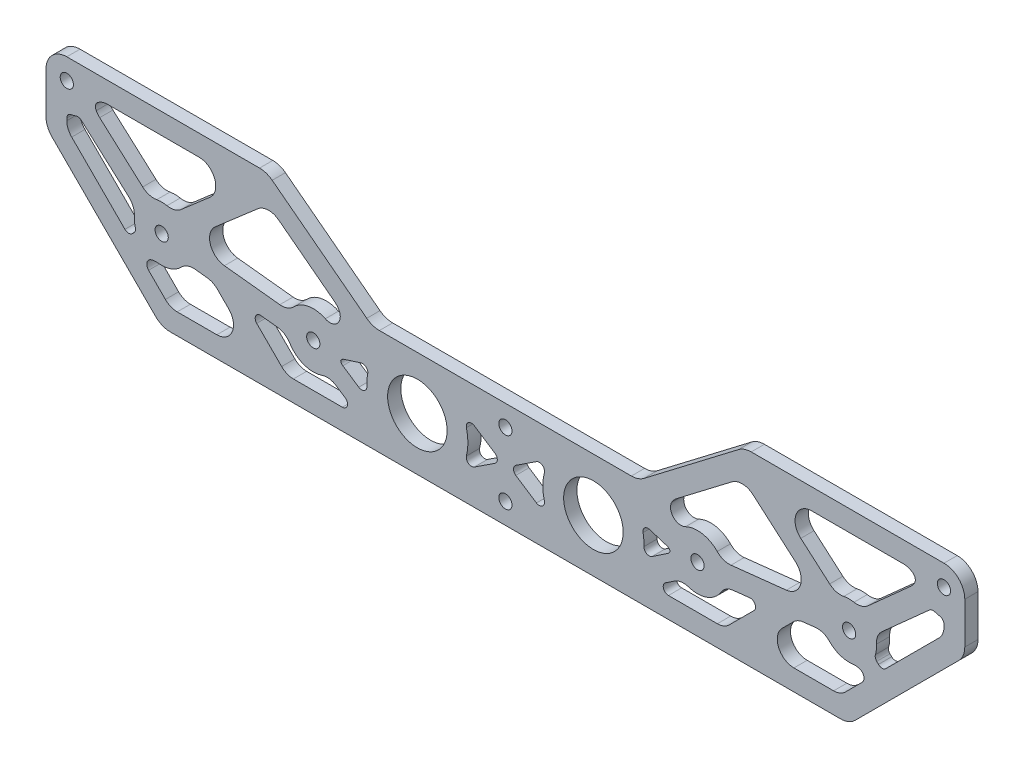
from build123d import *

# Parameters (mm, degrees)
SKETCH1_R           = 14.2875
SKETCH1_R_2         = 3.175
BOSS_EXTRUDE1_DEPTH = 6.35
FILLET1_R           = 10
CUT_EXTRUDE1_DEPTH  = 10
FILLET2_R           = 2.5
FILLET3_DEPTH       = 6.35
FILLET4_R           = 8
FILLET5_R           = 8
FILLET6_R           = 3
FILLET7_R           = 8
FILLET8_R           = 5
FILLET9_R           = 3
FILLET10_R          = 8


with BuildPart() as part:
    # Sketch1 → Boss-Extrude1 (new body)
    with BuildSketch(Plane.XY):
        Polygon((-62.442934658, -37.279495554), (267.757065342, -37.279495554), (323.315335232, 18.278774336), (323.315335232, 52.320504446), (217.352871158, 52.320504446), (166.552871158, 13.520504446), (38.761259526, 13.520504446), (-12.038740474, 52.320504446), (-118.001204548, 52.320504446), (-118.001204548, 18.278774336), align=None)
        with Locations((60.373820223, -11.879495554)):
            Circle(SKETCH1_R, mode=Mode.SUBTRACT)
        with Locations((-62.442934658, 1.520504446)):
            Circle(SKETCH1_R_2, mode=Mode.SUBTRACT)
        with Locations((10.373820223, -6.424213816)):
            Circle(SKETCH1_R_2, mode=Mode.SUBTRACT)
        with Locations((102.657065342, -27.279495554)):
            Circle(SKETCH1_R_2, mode=Mode.SUBTRACT)
        with Locations((144.940310462, -11.879495554)):
            Circle(SKETCH1_R, mode=Mode.SUBTRACT)
        with Locations((194.940310462, -6.424213816)):
            Circle(SKETCH1_R_2, mode=Mode.SUBTRACT)
        with Locations((102.657065342, 3.520504446)):
            Circle(SKETCH1_R_2, mode=Mode.SUBTRACT)
        with Locations((267.757065342, 1.520504446)):
            Circle(SKETCH1_R_2, mode=Mode.SUBTRACT)
        with Locations((313.315335232, 42.320504446)):
            Circle(SKETCH1_R_2, mode=Mode.SUBTRACT)
        with Locations((-108.001204548, 42.320504446)):
            Circle(SKETCH1_R_2, mode=Mode.SUBTRACT)
    extrude(amount=BOSS_EXTRUDE1_DEPTH)

    # Fillet1
    fillet1_edges = [part.edges().sort_by_distance(p)[0] for p in [
        (-118.001204548, 18.278774336, 3.175),
        (-118.001204548, 52.320504446, 3.175),
        (-12.038740474, 52.320504446, 3.175),
        (38.761259526, 13.520504446, 3.175),
        (166.552871158, 13.520504446, 3.175),
        (217.352871158, 52.320504446, 3.175),
        (323.315335232, 52.320504446, 3.175),
        (323.315335232, 18.278774336, 3.175),
        (267.757065342, -37.279495554, 3.175),
        (-62.442934658, -37.279495554, 3.175),
    ]]
    fillet(fillet1_edges, radius=FILLET1_R)

    # Sketch2 → Cut-Extrude1 (cut)
    with BuildSketch(Plane.XY.offset(6.35)):
        with BuildLine():
            ThreePointArc((23.505920872, -7.486549706), (23.419545179, -8.265323632), (23.28702714, -9.037585605))
            Line((23.28702714, -9.037585605), (36.905820905, -18.135345959))
            ThreePointArc((36.905820905, -18.135345959), (36.127690836, -10.462503664), (37.794303215, -2.932536966))
            Line((37.794303215, -2.932536966), (23.505920872, -7.486549706))
        make_face()
        with BuildLine():
            Line((-74.858923583, 5.927753475), (-102.256554243, 30.463876853))
            ThreePointArc((-102.256554243, 30.463876853), (-105.054209768, 29.479326667), (-108.001204548, 29.145504446))
            Line((-108.001204548, 29.145504446), (-108.001204548, 22.42090996))
            Line((-108.001204548, 22.42090996), (-78.307400752, -7.272893836))
            Line((-78.307400752, -7.272893836), (-74.597651385, -3.563144469))
            ThreePointArc((-74.597651385, -3.563144469), (-75.612945288, 1.157951013), (-74.858923583, 5.927753475))
        make_face()
        with BuildLine():
            Line((-23.050139283, 42.320504446), (-94.826204548, 42.320504446))
            ThreePointArc((-94.826204548, 42.320504446), (-95.017343814, 40.084439722), (-95.585215622, 37.913255418))
            Line((-95.585215622, 37.913255418), (-68.187584962, 13.377132039))
            ThreePointArc((-68.187584962, 13.377132039), (-62.339595002, 14.695099162), (-56.512999229, 13.285558242))
            Line((-56.512999229, 13.285558242), (-23.050139283, 42.320504446))
        make_face()
        with BuildLine():
            Line((-67.526583573, -10.63421228), (-71.23633294, -14.343961648))
            Line((-71.23633294, -14.343961648), (-58.300799034, -27.279495554))
            Line((-58.300799034, -27.279495554), (-16.619224161, -27.279495554))
            Line((-16.619224161, -27.279495554), (-37.688728757, -6.209990957))
            Line((-37.688728757, -6.209990957), (-50.867789262, -4.772081195))
            ThreePointArc((-50.867789262, -4.772081195), (-58.069603335, -10.907471984), (-67.526583573, -10.63421228))
        make_face()
        with BuildLine():
            Line((30.003625706, 7.626245825), (-11.363222422, 39.221397545))
            Line((-11.363222422, 39.221397545), (-49.959338032, 5.732444651))
            ThreePointArc((-49.959338032, 5.732444651), (-49.868096719, 5.45167168), (-49.783169494, 5.168924788))
            Line((-49.783169494, 5.168924788), (-1.201325173, -0.131628174))
            ThreePointArc((-1.201325173, -0.131628174), (9.059387493, 6.685053578), (20.46921657, 2.041221648))
            Line((20.46921657, 2.041221648), (32.633437977, 5.926134389))
            ThreePointArc((32.633437977, 5.926134389), (31.285206333, 6.724640645), (30.003625706, 7.626245825))
        make_face()
        with BuildLine():
            Line((-21.814640677, -7.941943413), (-2.477088537, -27.279495554))
            Line((-2.477088537, -27.279495554), (32.591759865, -27.279495554))
            Line((32.591759865, -27.279495554), (17.732180345, -17.352853315))
            ThreePointArc((17.732180345, -17.352853315), (5.870863239, -18.805813204), (-2.285944941, -10.072634157))
            Line((-2.285944941, -10.072634157), (-21.814640677, -7.941943413))
        make_face()
        with BuildLine():
            Line((187.581950339, -17.352853315), (172.722370819, -27.279495554))
            Line((172.722370819, -27.279495554), (207.791219222, -27.279495554))
            Line((207.791219222, -27.279495554), (227.128771362, -7.941943413))
            Line((227.128771362, -7.941943413), (207.600075626, -10.072634157))
            ThreePointArc((207.600075626, -10.072634157), (199.443267446, -18.805813204), (187.581950339, -17.352853315))
        make_face()
        with BuildLine():
            Line((243.002859442, -6.209990957), (221.933354845, -27.279495554))
            Line((221.933354845, -27.279495554), (263.614929719, -27.279495554))
            Line((263.614929719, -27.279495554), (276.550463625, -14.343961648))
            Line((276.550463625, -14.343961648), (272.840714257, -10.63421228))
            ThreePointArc((272.840714257, -10.63421228), (263.38373402, -10.907471984), (256.181919946, -4.772081195))
            Line((256.181919946, -4.772081195), (243.002859442, -6.209990957))
        make_face()
        with BuildLine():
            Line((168.408309779, -18.135345959), (182.027103545, -9.037585605))
            ThreePointArc((182.027103545, -9.037585605), (181.894585505, -8.265323632), (181.808209813, -7.486549706))
            Line((181.808209813, -7.486549706), (167.519827469, -2.932536966))
            ThreePointArc((167.519827469, -2.932536966), (169.186439849, -10.462503664), (168.408309779, -18.135345959))
        make_face()
        with BuildLine():
            ThreePointArc((175.310504979, 7.626245825), (174.028924351, 6.724640645), (172.680692708, 5.926134389))
            Line((172.680692708, 5.926134389), (184.844914115, 2.041221648))
            ThreePointArc((184.844914115, 2.041221648), (196.254743191, 6.685053578), (206.515455858, -0.131628174))
            Line((206.515455858, -0.131628174), (255.097300178, 5.168924788))
            ThreePointArc((255.097300178, 5.168924788), (255.182227404, 5.45167168), (255.273468717, 5.732444651))
            Line((255.273468717, 5.732444651), (216.677353107, 39.221397545))
            Line((216.677353107, 39.221397545), (175.310504979, 7.626245825))
        make_face()
        with BuildLine():
            Line((279.911782069, -3.563144469), (283.621531436, -7.272893836))
            Line((283.621531436, -7.272893836), (313.315335232, 22.42090996))
            Line((313.315335232, 22.42090996), (313.315335232, 29.145504446))
            ThreePointArc((313.315335232, 29.145504446), (310.368340453, 29.479326667), (307.570684928, 30.463876853))
            Line((307.570684928, 30.463876853), (280.173054268, 5.927753475))
            ThreePointArc((280.173054268, 5.927753475), (280.927075973, 1.157951013), (279.911782069, -3.563144469))
        make_face()
        with BuildLine():
            Line((228.364269968, 42.320504446), (261.827129914, 13.285558242))
            ThreePointArc((261.827129914, 13.285558242), (267.653725687, 14.695099162), (273.501715647, 13.377132039))
            Line((273.501715647, 13.377132039), (300.899346307, 37.913255418))
            ThreePointArc((300.899346307, 37.913255418), (300.331474499, 40.084439722), (300.140335232, 42.320504446))
            Line((300.140335232, 42.320504446), (228.364269968, 42.320504446))
        make_face()
        with BuildLine():
            Line((124.499254422, 1.237130698), (104.481636284, -11.879495554))
            Line((104.481636284, -11.879495554), (124.499254422, -24.996121805))
            ThreePointArc((124.499254422, -24.996121805), (120.652810462, -11.879495554), (124.499254422, 1.237130698))
        make_face()
        with BuildLine():
            Line((100.832494401, -11.879495554), (80.814876263, 1.237130698))
            ThreePointArc((80.814876263, 1.237130698), (84.661320223, -11.879495554), (80.814876263, -24.996121805))
            Line((80.814876263, -24.996121805), (100.832494401, -11.879495554))
        make_face()
    extrude(amount=-CUT_EXTRUDE1_DEPTH, mode=Mode.SUBTRACT)

    # Fillet2
    # the kernel refuses this fillet: 2.5 mm, written as the material it adds along each edge
    with BuildSketch(Plane(origin=(124.499254422, -24.996121805, 6.35), x_dir=(-0.8364298099761919, 0.5480740579366914, 0), z_dir=(0, 0, -1)), Plane(origin=(80.814876263, 1.237130698, 6.35), x_dir=(0.8364298099761912, -0.5480740579366923, 0), z_dir=(0, 0, -1))) as fillet2_piece_1:
        with BuildLine():
            CenterArc((8.270761151, 2.5), FILLET2_R, 132.738385679, 137.261614321)
            ThreePointArc((6.574131455, 4.336150232), (3.463988922, 1.899838021), (0, 0))
            Line((0, 0), (8.270761151, 0))
        make_face()
    extrude(amount=6.35)
    with BuildSketch(Plane(origin=(104.481636284, -11.879495554, 6.35), x_dir=(0.836429809976191, 0.5480740579366925, 0), z_dir=(0, 0, -1)), Plane(origin=(100.832494401, -11.879495554, 6.35), x_dir=(-0.836429809976192, -0.5480740579366911, 0), z_dir=(0, 0, -1))) as fillet2_piece_2:
        with BuildLine():
            CenterArc((FILLET2_R * 1.52612552604, FILLET2_R), FILLET2_R, 156.469970738, 113.530029262)
            Line((FILLET2_R * 0.609274565772, FILLET2_R * 1.39922965403), (0, 0))
            Line((0, 0), (FILLET2_R * 1.52612552604, 0))
        make_face()
    extrude(amount=6.35)
    with BuildSketch(Plane(origin=(124.499254422, 1.237130698, 6.35), x_dir=(-0.8364298099761911, -0.5480740579366926, 0), z_dir=(0, 0, -1)), Plane(origin=(80.814876263, -24.996121805, 6.35), x_dir=(0.8364298099761913, 0.5480740579366921, 0), z_dir=(0, 0, -1))) as fillet2_piece_3:
        with BuildLine():
            CenterArc((8.270761151, -2.5), FILLET2_R, 90, 137.261614321)
            ThreePointArc((6.574131455, -4.336150232), (3.463988922, -1.899838021), (0, 0))
            Line((0, 0), (8.270761151, 0))
        make_face()
    extrude(amount=6.35)
    with BuildSketch(Plane(origin=(36.905820905, -18.135345959, 6.35), x_dir=(-0.8315267709778132, 0.5554846794891928, 0), z_dir=(0, 0, -1))) as fillet2_piece_4:
        with BuildLine():
            CenterArc((5.637586761, 2.5), FILLET2_R, 144.019234869, 125.980765131)
            ThreePointArc((3.614551073, 3.968784057), (1.917261006, 1.884223289), (0, 0))
            Line((0, 0), (5.637586761, 0))
        make_face()
    extrude(amount=6.35)
    with BuildSketch(Plane(origin=(37.794303215, -2.932536966, 6.35), x_dir=(-0.9527771354410546, -0.3036704302047504, 0), z_dir=(0, 0, -1))) as fillet2_piece_5:
        with BuildLine():
            CenterArc((4.690805929, -2.5), FILLET2_R, 90, 118.741955759)
            ThreePointArc((2.498820236, -3.702164183), (1.334695889, -1.793517434), (0, 0))
            Line((0, 0), (4.690805929, 0))
        make_face()
    extrude(amount=6.35)
    with BuildSketch(Plane(origin=(23.28702714, -9.037585605, 6.35), x_dir=(0.14435302535723496, 0.989526252340085, 0), z_dir=(0, 0, -1)), Plane(origin=(181.808209813, -7.486549706, 6.35), x_dir=(0.13512930422682767, -0.9908279725255911, 0), z_dir=(0, 0, -1)), Plane(origin=(307.570684928, 30.463876853, 6.35), x_dir=(0.9224742738611128, -0.3860585629984297, 0), z_dir=(0, 0, -1))) as fillet2_piece_6:
        with BuildLine():
            CenterArc((1.580869434, 2.496243903), FILLET2_R, 205.444288667, 61.414548907)
            Line((-0.676639225, 1.422160733), (0, 0))
            ThreePointArc((0, 0), (0.721939507, 0.019794629), (1.443879015, 0))
        make_face()
    extrude(amount=6.35)
    with BuildSketch(Plane(origin=(23.505920872, -7.486549706, 6.35), x_dir=(0.9527771354410546, 0.3036704302047506, 0), z_dir=(0, 0, -1)), Plane(origin=(182.027103545, -9.037585605, 6.35), x_dir=(-0.8315267709778119, -0.5554846794891947, 0), z_dir=(0, 0, -1)), Plane(origin=(-74.597651385, -3.563144469, 6.35), x_dir=(-0.7071067811865465, -0.7071067811865487, 0), z_dir=(0, 0, -1)), Plane(origin=(-102.256554243, 30.463876853, 6.35), x_dir=(0.7449378564648427, -0.667133862133804, 0), z_dir=(0, 0, -1))) as fillet2_piece_7:
        with BuildLine():
            CenterArc((1.574922789, 2.5), FILLET2_R, 208.585451093, 61.414548907)
            ThreePointArc((-0.62033846, 1.303827751), (-0.292294611, 0.660418307), (0, 0))
            Line((0, 0), (1.574922789, 0))
        make_face()
    extrude(amount=6.35)
    with BuildSketch(Plane(origin=(168.408309779, -18.135345959, 6.35), x_dir=(0.8315267709778126, 0.555484679489194, 0), z_dir=(0, 0, -1))) as fillet2_piece_8:
        with BuildLine():
            CenterArc((5.637586761, -2.5), FILLET2_R, 90, 125.980765131)
            ThreePointArc((3.614551073, -3.968784057), (1.917261006, -1.884223289), (0, 0))
            Line((0, 0), (5.637586761, 0))
        make_face()
    extrude(amount=6.35)
    with BuildSketch(Plane(origin=(167.519827469, -2.932536966, 6.35), x_dir=(0.9527771354410542, -0.3036704302047514, 0), z_dir=(0, 0, -1))) as fillet2_piece_9:
        with BuildLine():
            CenterArc((4.690805929, 2.5), FILLET2_R, 151.258044241, 118.741955759)
            ThreePointArc((2.498820236, 3.702164183), (1.334695889, 1.793517434), (0, 0))
            Line((0, 0), (4.690805929, 0))
        make_face()
    extrude(amount=6.35)
    with BuildSketch(Plane(origin=(-21.814640677, -7.941943413, 6.35), x_dir=(0.9941005983250841, -0.10846197679237511, 0), z_dir=(0, 0, -1)), Plane(origin=(227.128771362, -7.941943413, 6.35), x_dir=(-0.7071067811865478, -0.7071067811865472, 0), z_dir=(0, 0, -1))) as fillet2_piece_10:
        with BuildLine():
            CenterArc((FILLET2_R * 2.8417642098, FILLET2_R), FILLET2_R, 128.773337141, 141.226662859)
            Line((FILLET2_R * 2.21552313484, FILLET2_R * 1.77962947355), (0, 0))
            Line((0, 0), (FILLET2_R * 2.8417642098, 0))
        make_face()
    extrude(amount=6.35)
    with BuildSketch(Plane(origin=(32.591759865, -27.279495554, 6.35), x_dir=(-1, 0, 0), z_dir=(0, 0, -1)), Plane(origin=(172.722370819, -27.279495554, 6.35), x_dir=(0.8315267709778129, 0.5554846794891936, 0), z_dir=(0, 0, -1))) as fillet2_piece_11:
        with BuildLine():
            CenterArc((FILLET2_R * 3.2971688304, FILLET2_R), FILLET2_R, 123.74410479, 146.25589521)
            Line((FILLET2_R * 2.74168415091, FILLET2_R * 1.83152677098), (0, 0))
            Line((0, 0), (FILLET2_R * 3.2971688304, 0))
        make_face()
    extrude(amount=6.35)
    with BuildSketch(Plane(origin=(279.911782069, -3.563144469, 6.35), x_dir=(0.7071067811865567, -0.7071067811865384, 0), z_dir=(0, 0, -1))) as fillet2_piece_12:
        with BuildLine():
            CenterArc((1.574922789, -2.5), FILLET2_R, 90, 61.414548907)
            ThreePointArc((-0.62033846, -1.303827751), (-0.292294611, -0.660418307), (0, 0))
            Line((0, 0), (1.574922789, 0))
        make_face()
    extrude(amount=6.35)
    with BuildSketch(Plane(origin=(283.621531436, -7.272893836, 6.35), x_dir=(-0.707106781186556, 0.7071067811865389, 0), z_dir=(0, 0, -1))) as fillet2_piece_13:
        with BuildLine():
            CenterArc((FILLET2_R, FILLET2_R), FILLET2_R, 180, 90)
            Line((0, FILLET2_R), (0, 0))
            Line((0, 0), (FILLET2_R, 0))
        make_face()
    extrude(amount=6.35)
    with BuildSketch(Plane(origin=(-78.307400752, -7.272893836, 6.35), x_dir=(0.7071067811865476, 0.7071067811865476, 0), z_dir=(0, 0, -1))) as fillet2_piece_14:
        with BuildLine():
            CenterArc((FILLET2_R, -FILLET2_R), FILLET2_R, 90, 90)
            Line((0, -FILLET2_R), (0, 0))
            Line((0, 0), (FILLET2_R, 0))
        make_face()
    extrude(amount=6.35)
    with BuildSketch(Plane(origin=(-108.001204548, 29.145504446, 6.35), x_dir=(0.996794764075885, 0.08000123943352926, 0), z_dir=(0, 0, -1))) as fillet2_piece_15:
        with BuildLine():
            CenterArc((2.308035758, 2.49198691), FILLET2_R, 184.588636978, 80.822726043)
            Line((-0.183951153, 2.291983812), (0, 0))
            ThreePointArc((0, 0), (1.05401633, 0.042228983), (2.108032659, 0))
        make_face()
    extrude(amount=6.35)
    with BuildSketch(Plane(origin=(313.315335232, 29.145504446, 6.35), x_dir=(0, -1, 0), z_dir=(0, 0, -1))) as fillet2_piece_16:
        with BuildLine():
            CenterArc((2.299353783, 2.5), FILLET2_R, 189.177273957, 80.822726043)
            ThreePointArc((-0.168645225, 2.101275917), (-0.042228983, 1.05401633), (0, 0))
            Line((0, 0), (2.299353783, 0))
        make_face()
    extrude(amount=6.35)

    # Fillet3: read off the stored shape, not the designer's step
    # Fillet3 outline → Fillet3 (add)
    with BuildSketch(Plane.XY):
        with BuildLine():
            ThreePointArc((211.014076866, 0.359196726), (207.431725827, 0.786667832), (204.401466543, 2.744600208))
            ThreePointArc((204.401466543, 2.744600208), (205.556320418, 1.37841123), (206.515455858, -0.131628174))
            Line((206.515455858, -0.131628174), (211.014076866, 0.359196726))
        make_face()
        with BuildLine():
            Line((172.680692708, 5.926134389), (184.844914115, 2.041221648))
            ThreePointArc((184.844914115, 2.041221648), (181.600857992, 8.411550009), (184.744728864, 14.831912887))
            Line((184.744728864, 14.831912887), (175.310504979, 7.626245825))
            ThreePointArc((175.310504979, 7.626245825), (174.028924351, 6.724640645), (172.680692708, 5.926134389))
        make_face()
        with BuildLine():
            ThreePointArc((253.267424296, 7.473042793), (254.289203208, 6.405834356), (255.097300178, 5.168924788))
            ThreePointArc((255.097300178, 5.168924788), (255.182227404, 5.45167168), (255.273468717, 5.732444651))
            Line((255.273468717, 5.732444651), (253.267424296, 7.473042793))
        make_face()
        with BuildLine():
            Line((216.677353107, 39.221397545), (211.499590999, 35.266728848))
            ThreePointArc((211.499590999, 35.266728848), (216.60505587, 36.90513128), (221.598403693, 34.951516272))
            Line((221.598403693, 34.951516272), (216.677353107, 39.221397545))
        make_face()
        with BuildLine():
            ThreePointArc((0.912664141, 2.744600208), (-2.117595142, 0.786667832), (-5.699946181, 0.359196726))
            Line((-5.699946181, 0.359196726), (-1.201325173, -0.131628174))
            ThreePointArc((-1.201325173, -0.131628174), (-0.242189733, 1.37841123), (0.912664141, 2.744600208))
        make_face()
        with BuildLine():
            ThreePointArc((-49.959338032, 5.732444651), (-49.868096719, 5.45167168), (-49.783169494, 5.168924788))
            ThreePointArc((-49.783169494, 5.168924788), (-48.975072523, 6.405834356), (-47.953293611, 7.473042793))
            Line((-47.953293611, 7.473042793), (-49.959338032, 5.732444651))
        make_face()
        with BuildLine():
            ThreePointArc((20.56940182, 14.831912887), (23.713272692, 8.411550009), (20.46921657, 2.041221648))
            Line((20.46921657, 2.041221648), (32.633437977, 5.926134389))
            ThreePointArc((32.633437977, 5.926134389), (31.285206333, 6.724640645), (30.003625706, 7.626245825))
            Line((30.003625706, 7.626245825), (20.56940182, 14.831912887))
        make_face()
        with BuildLine():
            Line((-11.363222422, 39.221397545), (-16.284273008, 34.951516272))
            ThreePointArc((-16.284273008, 34.951516272), (-11.290925185, 36.90513128), (-6.185460314, 35.266728848))
            Line((-6.185460314, 35.266728848), (-11.363222422, 39.221397545))
        make_face()
        with BuildLine():
            Line((-58.300799034, -27.279495554), (-54.987090535, -27.279495554))
            ThreePointArc((-54.987090535, -27.279495554), (-58.048557994, -26.670531814), (-60.643944784, -24.936349803))
            Line((-60.643944784, -24.936349803), (-58.300799034, -27.279495554))
        make_face()
        with BuildLine():
            ThreePointArc((-30.27607841, -13.622641304), (-28.5418964, -22.340963013), (-35.93293266, -27.279495554))
            Line((-35.93293266, -27.279495554), (-16.619224161, -27.279495554))
            Line((-16.619224161, -27.279495554), (-30.27607841, -13.622641304))
        make_face()
        with BuildLine():
            Line((-67.526583573, -10.63421228), (-70.726466387, -13.834095095))
            ThreePointArc((-70.726466387, -13.834095095), (-67.665859968, -11.923948803), (-64.077242842, -11.552737759))
            ThreePointArc((-64.077242842, -11.552737759), (-65.833164615, -11.210833497), (-67.526583573, -10.63421228))
        make_face()
        with BuildLine():
            ThreePointArc((-52.981778576, -7.648309578), (-49.951519293, -5.690377201), (-46.369168254, -5.262906096))
            Line((-46.369168254, -5.262906096), (-50.867789262, -4.772081195))
            ThreePointArc((-50.867789262, -4.772081195), (-51.826924702, -6.2821206), (-52.981778576, -7.648309578))
        make_face()
        with BuildLine():
            Line((221.933354845, -27.279495554), (241.247063344, -27.279495554))
            ThreePointArc((241.247063344, -27.279495554), (233.856027084, -22.340963013), (235.590209095, -13.622641304))
            Line((235.590209095, -13.622641304), (221.933354845, -27.279495554))
        make_face()
        with BuildLine():
            Line((256.181919946, -4.772081195), (251.683298938, -5.262906096))
            ThreePointArc((251.683298938, -5.262906096), (255.265649978, -5.690377201), (258.295909261, -7.648309578))
            ThreePointArc((258.295909261, -7.648309578), (257.141055386, -6.2821206), (256.181919946, -4.772081195))
        make_face()
        with BuildLine():
            ThreePointArc((269.391373527, -11.552737759), (272.979990652, -11.923948803), (276.040597072, -13.834095095))
            Line((276.040597072, -13.834095095), (272.840714257, -10.63421228))
            ThreePointArc((272.840714257, -10.63421228), (271.147295299, -11.210833497), (269.391373527, -11.552737759))
        make_face()
        with BuildLine():
            Line((313.315335232, 22.42090996), (313.315335232, 25.734618459))
            ThreePointArc((313.315335232, 25.734618459), (312.706371492, 22.673151), (310.972189482, 20.077764209))
            Line((310.972189482, 20.077764209), (313.315335232, 22.42090996))
        make_face()
        with BuildLine():
            Line((-108.001204548, 22.42090996), (-105.658058797, 20.077764209))
            ThreePointArc((-105.658058797, 20.077764209), (-107.392240808, 22.673151), (-108.001204548, 25.734618459))
            Line((-108.001204548, 25.734618459), (-108.001204548, 22.42090996))
        make_face()
        with BuildLine():
            ThreePointArc((-94.710843669, 39.231452318), (-91.910717066, 41.506865938), (-88.395577167, 42.320504446))
            Line((-88.395577167, 42.320504446), (-94.826204548, 42.320504446))
            ThreePointArc((-94.826204548, 42.320504446), (-95.017343814, 40.084439722), (-95.585215622, 37.913255418))
            Line((-95.585215622, 37.913255418), (-92.214135174, 34.89426276))
            ThreePointArc((-92.214135174, 34.89426276), (-93.810362745, 36.862603833), (-94.710843669, 39.231452318))
        make_face()
        with BuildLine():
            Line((-23.050139283, 42.320504446), (-44.477079813, 42.320504446))
            ThreePointArc((-44.477079813, 42.320504446), (-36.98241748, 37.118724686), (-39.234150855, 28.278013574))
            Line((-39.234150855, 28.278013574), (-23.050139283, 42.320504446))
        make_face()
        with BuildLine():
            ThreePointArc((-64.794001652, 14.484034405), (-68.39760622, 14.657252847), (-71.55866541, 16.396124697))
            Line((-71.55866541, 16.396124697), (-68.187584962, 13.377132039))
            ThreePointArc((-68.187584962, 13.377132039), (-66.528453946, 14.04604464), (-64.794001652, 14.484034405))
        make_face()
        with BuildLine():
            Line((-56.512999229, 13.285558242), (-53.094975386, 16.251298127))
            ThreePointArc((-53.094975386, 16.251298127), (-56.282922876, 14.562226986), (-59.888801275, 14.445558708))
            ThreePointArc((-59.888801275, 14.445558708), (-58.161433032, 13.980414913), (-56.512999229, 13.285558242))
        make_face()
        with BuildLine():
            ThreePointArc((300.024974354, 39.231452318), (299.12449343, 36.862603833), (297.528265858, 34.89426276))
            Line((297.528265858, 34.89426276), (300.899346307, 37.913255418))
            ThreePointArc((300.899346307, 37.913255418), (300.331474499, 40.084439722), (300.140335232, 42.320504446))
            Line((300.140335232, 42.320504446), (293.709707851, 42.320504446))
            ThreePointArc((293.709707851, 42.320504446), (297.224847751, 41.506865938), (300.024974354, 39.231452318))
        make_face()
        with BuildLine():
            Line((273.501715647, 13.377132039), (276.872796095, 16.396124697))
            ThreePointArc((276.872796095, 16.396124697), (273.711736905, 14.657252847), (270.108132336, 14.484034405))
            ThreePointArc((270.108132336, 14.484034405), (271.842584631, 14.04604464), (273.501715647, 13.377132039))
        make_face()
        with BuildLine():
            ThreePointArc((244.54828154, 28.278013574), (242.296548164, 37.118724686), (249.791210497, 42.320504446))
            Line((249.791210497, 42.320504446), (228.364269968, 42.320504446))
            Line((228.364269968, 42.320504446), (244.54828154, 28.278013574))
        make_face()
        with BuildLine():
            ThreePointArc((261.827129914, 13.285558242), (263.475563717, 13.980414913), (265.202931959, 14.445558708))
            ThreePointArc((265.202931959, 14.445558708), (261.59705356, 14.562226986), (258.409106071, 16.251298127))
            Line((258.409106071, 16.251298127), (261.827129914, 13.285558242))
        make_face()
        with BuildLine():
            ThreePointArc((280.900420623, 2.433103461), (281.468499861, 5.995863135), (283.544134716, 8.946746132))
            Line((283.544134716, 8.946746132), (280.173054268, 5.927753475))
            ThreePointArc((280.173054268, 5.927753475), (280.655637502, 4.205175982), (280.900420623, 2.433103461))
        make_face()
        with BuildLine():
            ThreePointArc((183.819027546, -19.866597953), (187.193607633, -18.590596485), (190.785655576, -18.926992218))
            ThreePointArc((190.785655576, -18.926992218), (189.130245318, -18.248923877), (187.581950339, -17.352853315))
            Line((187.581950339, -17.352853315), (183.819027546, -19.866597953))
        make_face()
        with BuildLine():
            ThreePointArc((206.156066314, -13.337060238), (208.692812831, -10.771736161), (212.098696634, -9.581809257))
            Line((212.098696634, -9.581809257), (207.600075626, -10.072634157))
            ThreePointArc((207.600075626, -10.072634157), (206.989138013, -11.753977379), (206.156066314, -13.337060238))
        make_face()
        with BuildLine():
            ThreePointArc((-6.784565949, -9.581809257), (-3.378682147, -10.771736161), (-0.84193563, -13.337060238))
            ThreePointArc((-0.84193563, -13.337060238), (-1.675007328, -11.753977378), (-2.285944941, -10.072634157))
            Line((-2.285944941, -10.072634157), (-6.784565949, -9.581809257))
        make_face()
        with BuildLine():
            ThreePointArc((17.732180345, -17.352853315), (16.183885366, -18.248923877), (14.528475108, -18.926992218))
            ThreePointArc((14.528475108, -18.926992218), (18.120523051, -18.590596485), (21.495103139, -19.866597953))
            Line((21.495103139, -19.866597953), (17.732180345, -17.352853315))
        make_face()
        with BuildLine():
            ThreePointArc((-78.230004032, 8.946746132), (-76.154369176, 5.995863135), (-75.586289939, 2.433103461))
            ThreePointArc((-75.586289939, 2.433103461), (-75.341506817, 4.205175982), (-74.858923583, 5.927753475))
            Line((-74.858923583, 5.927753475), (-78.230004032, 8.946746132))
        make_face()
    extrude(amount=FILLET3_DEPTH)

    # Fillet4
    fillet4_edges = [part.edges().sort_by_distance(p)[0] for p in [
        (-49.783169494, 5.168924788, 3.175),
        (255.097300178, 5.168924788, 3.175),
    ]]
    fillet(fillet4_edges, radius=FILLET4_R)

    # Fillet5
    # the kernel refuses this fillet: 8 mm, written as the material it adds along each edge
    with BuildSketch(Plane(origin=(276.550463625, -14.343961648, 6.35), x_dir=(-0.7071067811865465, -0.7071067811865486, 0), z_dir=(0, 0, -1))) as fillet5_piece_1:
        with BuildLine():
            CenterArc((3.319191964, 8), FILLET5_R, 245.487044087, 24.512955913)
            Line((0, 0.721060194), (-0.066383839, 0.575481398))
            ThreePointArc((-0.066383839, 0.575481398), (-0.16, 0.360530097), (-0.16, 0))
            Line((-0.16, 0), (0, -0.16))
            Line((0, -0.16), (3.319191964, -0.16))
            Line((3.319191964, -0.16), (3.319191964, 0))
        make_face()
    extrude(amount=6.35)
    with BuildSketch(Plane(origin=(-71.23633294, -14.343961648, 6.35), x_dir=(0.7071067811865467, -0.7071067811865483, 0), z_dir=(0, 0, -1))) as fillet5_piece_2:
        with BuildLine():
            CenterArc((3.319191965, -8), FILLET5_R, 90, 24.512955918)
            Line((0, -0.721060194), (-0.066383839, -0.575481398))
            ThreePointArc((-0.066383839, -0.575481398), (-0.16, -0.360530097), (-0.16, 0))
            Line((-0.16, 0), (0, 0.16))
            Line((0, 0.16), (3.319191965, 0.16))
            Line((3.319191965, 0.16), (3.319191965, 0))
        make_face()
    extrude(amount=6.35)

    # Fillet6
    fillet6_edges = [part.edges().sort_by_distance(p)[0] for p in [
        (276.040597072, -13.834095095, 3.175),
        (-70.726466387, -13.834095095, 3.175),
    ]]
    fillet(fillet6_edges, radius=FILLET6_R)

    # Fillet7
    fillet7_edges = [part.edges().sort_by_distance(p)[0] for p in [
        (-2.477088537, -27.279495554, 3.175),
        (207.791219222, -27.279495554, 3.175),
        (263.614929719, -27.279495554, 3.175),
    ]]
    fillet(fillet7_edges, radius=FILLET7_R)

    # Fillet8
    fillet8_edges = [part.edges().sort_by_distance(p)[0] for p in [
        (184.844914115, 2.041221648, 3.175),
        (20.46921657, 2.041221648, 3.175),
    ]]
    fillet(fillet8_edges, radius=FILLET8_R)

    # Fillet9
    fillet9_edges = [part.edges().sort_by_distance(p)[0] for p in [
        (-94.710843669, 39.231452318, 3.175),
        (300.024974354, 39.231452318, 3.175),
    ]]
    fillet(fillet9_edges, radius=FILLET9_R)

    # Fillet10
    fillet10_edges = [part.edges().sort_by_distance(p)[0] for p in [
        (-37.688728757, -6.209990957, 3.175),
        (243.002859442, -6.209990957, 3.175),
    ]]
    fillet(fillet10_edges, radius=FILLET10_R)


solid = part.part
